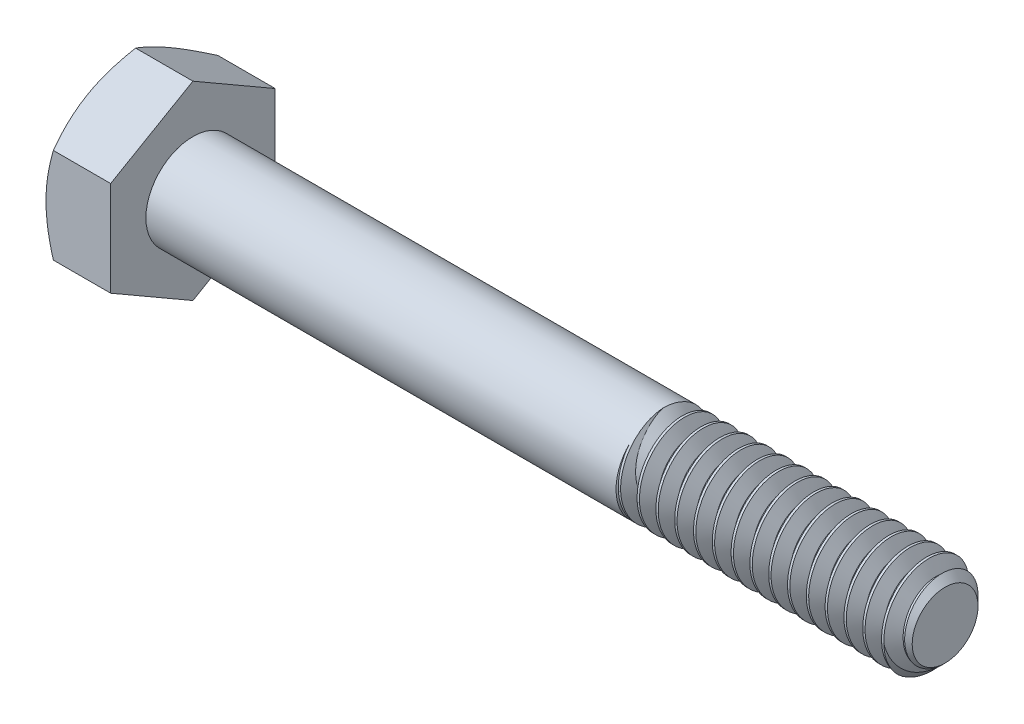
from build123d import *

# Parameters (mm, degrees)
SKETCH5_R           = 3.175
BOSS_EXTRUDE3_DEPTH = 50.8
CHAMFER1_SIZE       = 0.9525
CUT_SWEEP1_PITCH    = 1.27
BOSS_EXTRUDE4_DEPTH = 4.365625
SKETCH8_OUTSIDE_W   = 221.468
SKETCH8_OUTSIDE_H   = 223.188
SKETCH8_OUTSIDE_R   = 5.55625
CUT_EXTRUDE3_DEPTH  = 56.814699308
CUT_EXTRUDE3_DRAFT  = -60
CUT_EXTRUDE4_DEPTH  = 0.254
CIRPATTERN1_COUNT   = 6


with BuildPart() as part:
    # Sketch5 → Boss-Extrude3 (new body)
    with BuildSketch(Plane(origin=(27.5828125, 0, 0), x_dir=(0, 0, -1), z_dir=(1, 0, 0))):
        Circle(SKETCH5_R)
    extrude(amount=-BOSS_EXTRUDE3_DEPTH)

    # Chamfer1
    chamfer1_edges = [part.edges().sort_by_distance(p)[0] for p in [
        (27.5828125, 0, 3.175),
    ]]
    chamfer(chamfer1_edges, length=CHAMFER1_SIZE)

    # Cut-Sweep1: the profile of Sketch10 profile screwed along a right-hand helix of 16 turns, 8 arcs to a turn; built about Z, then put on its axis
    cut_sweep1_z = Axis((0, 0, 0), (0, 0, 1))
    cut_sweep1_corners = [(3.1753, 0, 0.000173205), (2.350110803, 0, -0.47625), (2.350110803, 0, -0.635), (3.1753, 0, -1.111423205)]
    with BuildLine(mode=Mode.PRIVATE) as cut_sweep1_profile:
        Line(cut_sweep1_corners[0], cut_sweep1_corners[1])
        Line(cut_sweep1_corners[1], cut_sweep1_corners[2])
        Line(cut_sweep1_corners[2], cut_sweep1_corners[3])
        Line(cut_sweep1_corners[3], cut_sweep1_corners[0])
    cut_sweep1_cap = Face(cut_sweep1_profile.wire())
    cut_sweep1_turn_angles = [0, 22.5, 45, 67.5, 90, 112.5, 135, 157.5, 180, 202.5, 225, 247.5, 270, 292.5, 315, 337.5, 360]
    cut_sweep1_turn_weights = [1, 0.9238795325112867, 1, 0.9238795325112867, 1, 0.9238795325112867, 1, 0.9238795325112867, 1, 0.9238795325112867, 1, 0.9238795325112867, 1, 0.9238795325112867, 1, 0.9238795325112867, 1]
    cut_sweep1_turn_rails = [Edge.make_bspline([Vector(p[0], p[1], 0).rotate(cut_sweep1_z, cut_sweep1_turn_angles[k]) / cut_sweep1_turn_weights[k] + Vector(0, 0, p[2] + CUT_SWEEP1_PITCH * cut_sweep1_turn_angles[k] / 360) for k in range(17)], [0, 0, 0, 1, 1, 2, 2, 3, 3, 4, 4, 5, 5, 6, 6, 7, 7, 8, 8, 8], 2, cut_sweep1_turn_weights) for p in cut_sweep1_corners]
    cut_sweep1_turn_sides = [Face.make_surface_from_curves(cut_sweep1_turn_rails[p[0]], cut_sweep1_turn_rails[p[1]]) for p in [(0, 1), (1, 2), (2, 3), (3, 0)]]
    cut_sweep1 = Plane(origin=(27.5828125, 0, 0), x_dir=(0, 1, 0), z_dir=(-1, 0, 0)) * Solid(Shell([*[p.moved(Location((0, 0, CUT_SWEEP1_PITCH * i))) for i in range(16) for p in cut_sweep1_turn_sides], cut_sweep1_cap, cut_sweep1_cap.rotate(cut_sweep1_z, 5760).moved(Location((0, 0, CUT_SWEEP1_PITCH * 5760 / 360)))]))
    add(cut_sweep1, mode=Mode.SUBTRACT)

    # Sketch11 → Revolve1 (revolve)
    with BuildSketch(Plane.XY, mode=Mode.PRIVATE) as revolve1_sk:
        Polygon((-23.2171875, 3.175), (-23.2171875, 0), (11.7078125, 0), (8.5328125, 3.175), align=None)
    revolve(revolve1_sk.sketch.rotate(Axis((-23.2171875, 0, 0), (1, 0, 0)), 270), axis=Axis((-23.2171875, 0, 0), (1, 0, 0)))

    # Sketch6 → Boss-Extrude4 (add)
    with BuildSketch(Plane.ZY.offset(23.2171875)):
        Polygon((5.55625, 3.207902433), (0, 6.415804866), (-5.55625, 3.207902433), (-5.55625, -3.207902433), (0, -6.415804866), (5.55625, -3.207902433), align=None)
    extrude(amount=BOSS_EXTRUDE4_DEPTH)


with BuildPart() as cut_extrude3_tool:
    # Sketch8 outside → Cut-Extrude3 (with draft: the straight prism first)
    with BuildSketch(Plane.ZY.offset(27.5828125)):
        Rectangle(SKETCH8_OUTSIDE_W, SKETCH8_OUTSIDE_H)
        Circle(SKETCH8_OUTSIDE_R, mode=Mode.SUBTRACT)
    extrude(amount=-CUT_EXTRUDE3_DEPTH)
    # Cut-Extrude3: the draft: its side faces are tilted about the plane it starts from
    cut_extrude3_sides = [cut_extrude3_tool.faces().sort_by_distance(p)[0] for p in [
        (0.824537154, -111.594, 0),
        (0.824537154, 0, 110.734),
        (0.824537154, 111.594, 0),
        (0.824537154, 0, -110.734),
        (0.824537154, 0, -5.55625),
    ]]
    draft(cut_extrude3_sides, Plane.ZY.offset(27.5828125), CUT_EXTRUDE3_DRAFT)


with BuildPart() as part_1:
    add(part.part)

    # Cut-Extrude3: cut by cut_extrude3_tool
    add(cut_extrude3_tool.part, mode=Mode.SUBTRACT)

    # Sketch12 → Cut-Extrude4 (cut)
    with BuildSketch(Plane.ZY.offset(27.5828125)):
        with BuildLine():
            Line((0.1666875, 4.2783125), (0.1666875, 2.3891875))
            ThreePointArc((0.1666875, 2.3891875), (0, 2.2225), (-0.1666875, 2.3891875))
            Line((-0.1666875, 2.3891875), (-0.1666875, 4.2783125))
            ThreePointArc((-0.1666875, 4.2783125), (0, 4.445), (0.1666875, 4.2783125))
        make_face()
    cut_extrude4 = extrude(amount=-CUT_EXTRUDE4_DEPTH, mode=Mode.SUBTRACT)

    # CirPattern1: Cut-Extrude4 ×6 about axis
    cirpattern1_axis = Axis((0, 0, 0), (1, 0, 0))
    for i in range(1, CIRPATTERN1_COUNT):
        add(cut_extrude4.rotate(cirpattern1_axis, i * 360 / CIRPATTERN1_COUNT), mode=Mode.SUBTRACT)


solid = part_1.part
